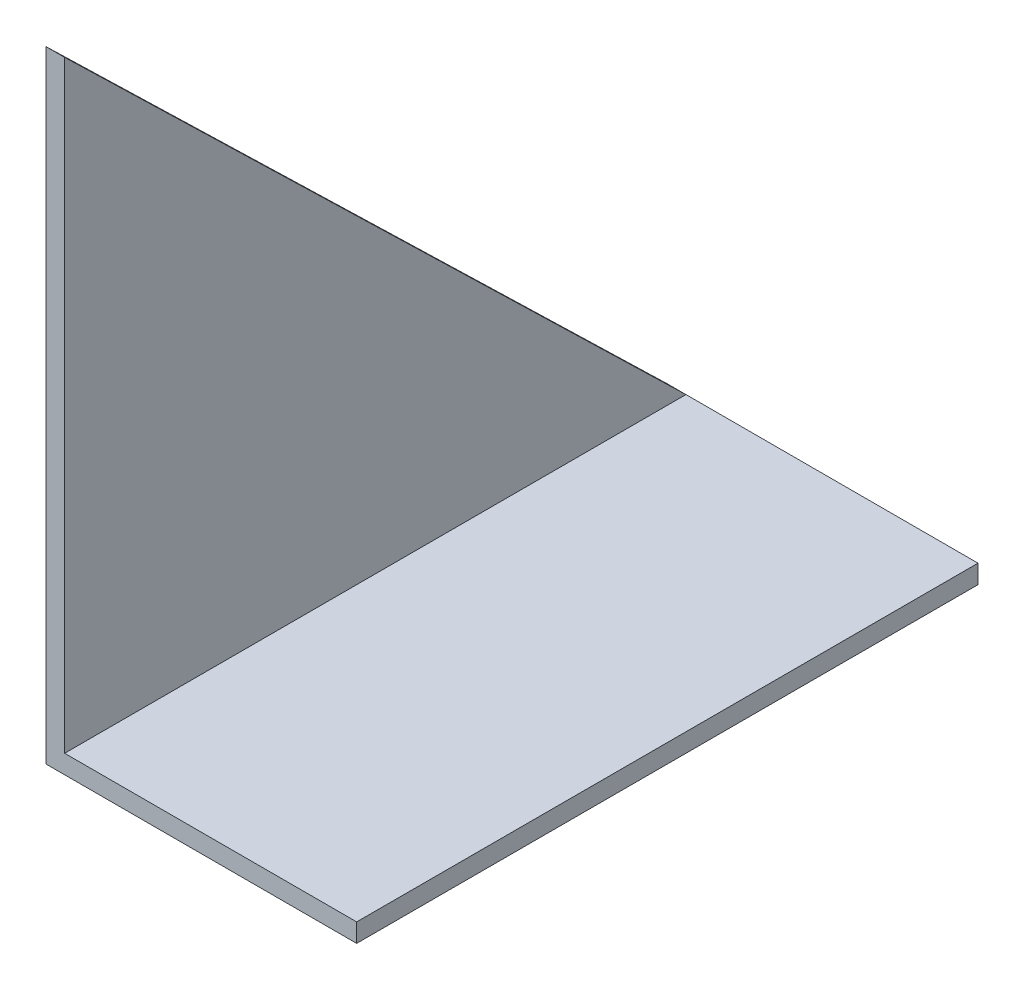
from build123d import *

# Parameters (mm, degrees)
SALIENTE_EXTRUIR1_DEPTH = 50
CORTAR_EXTRUIR1_DEPTH   = 100


with BuildPart() as part:
    # Croquis1 → Saliente-Extruir1 (new, symmetric)
    with BuildSketch(Plane.XY):
        Polygon((-1.5, -50), (48.5, -50), (48.5, -47), (1.5, -47), (1.5, 50), (-1.5, 50), align=None)
    extrude(amount=SALIENTE_EXTRUIR1_DEPTH, both=True)

    # Croquis2 → Cortar-Extruir1 (cut)
    with BuildSketch(Plane(origin=(1.5, 0, 0), x_dir=(0, 0, -1), z_dir=(1, 0, 0))):
        Polygon((50, 50), (-50, 50), (50, -47), align=None)
    extrude(amount=-CORTAR_EXTRUIR1_DEPTH, mode=Mode.SUBTRACT)


solid = part.part
